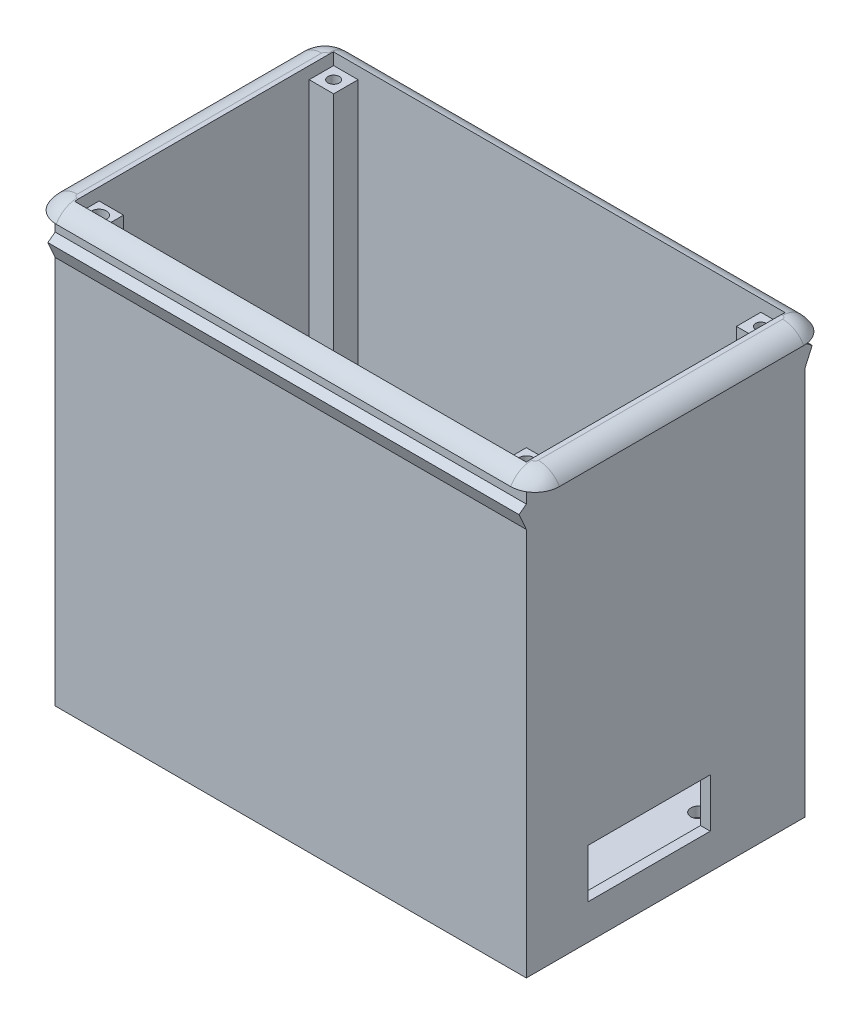
from build123d import *

# Parameters (mm, degrees)
BOSS_EXTRUDE1_DEPTH = 2.5
FILLET1_R           = 5
SKETCH2_W           = 96.44
SKETCH2_H           = 57
SKETCH2_W_2         = 92.44
SKETCH2_H_2         = 53
BOSS_EXTRUDE2_DEPTH = 85
SKETCH4_W           = 92.44
SKETCH4_H           = 53
CUT_EXTRUDE1_DEPTH  = 104.813534763
SKETCH3_W           = 96.44
SKETCH3_H           = 57
BOSS_EXTRUDE3_DEPTH = 2
BOSS_EXTRUDE4_DEPTH = 96.44
SKETCH6_W           = 5
SKETCH6_H           = 5
BOSS_EXTRUDE5_DEPTH = 85
SKETCH7_R           = 1.6
CUT_EXTRUDE2_DEPTH  = 106.870203551
SKETCH8_W           = 25
SKETCH8_H           = 10
CUT_EXTRUDE3_DEPTH  = 136.694798721
SKETCH9_R           = 1.5
SKETCH9_R_2         = 1.08347565
SKETCH9_R_3         = 1.156670199
CUT_EXTRUDE4_DEPTH  = 106.457337345


with BuildPart() as part:
    # Sketch1 → Boss-Extrude1 (new body)
    with BuildSketch(Plane(origin=(0, 0, 0), x_dir=(1, 0, 0), z_dir=(0, 1, 0))):
        with BuildLine():
            Line((-46.5, 30), (46.5, 30))
            ThreePointArc((46.5, 30), (50.035533906, 28.535533906), (51.5, 25))
            Line((51.5, 25), (51.5, -25))
            ThreePointArc((51.5, -25), (50.035533906, -28.535533906), (46.5, -30))
            Line((46.5, -30), (-46.5, -30))
            ThreePointArc((-46.5, -30), (-50.035533906, -28.535533906), (-51.5, -25))
            Line((-51.5, -25), (-51.5, 25))
            ThreePointArc((-51.5, 25), (-50.035533906, 28.535533906), (-46.5, 30))
        make_face()
    extrude(amount=BOSS_EXTRUDE1_DEPTH)

    # Fillet1
    # the kernel refuses this fillet: 5 mm, written as the material it takes off along each edge
    with BuildSketch(Plane(origin=(-46.5, 2.5, -25), x_dir=(-1, 0, 0), z_dir=(0, 0, 1))) as fillet1_piece_1:
        with BuildLine():
            CenterArc((0.669872981, 5), FILLET1_R, 270, 60)
            Line((0.669872981, 0), (0.669872981, -0.1))
            Line((0.669872981, -0.1), (5, -0.1))
            Line((5, -0.1), (5.1, 0))
            ThreePointArc((5.1, 0), (5.1, 1.25), (5.08660254, 2.45))
            Line((5.08660254, 2.45), (5, 2.5))
        make_face()
    revolve(axis=Axis((-46.5, 2.5, -25), (0, -1, 0)), revolution_arc=90, mode=Mode.SUBTRACT)
    with BuildSketch(Plane(origin=(-46.5, 2.5, -30), x_dir=(0, -1, 0), z_dir=(1, 0, 0)), Plane(origin=(46.5, 2.5, 30), x_dir=(0, -1, 0), z_dir=(-1, 0, 0))) as fillet1_piece_2:
        with BuildLine():
            CenterArc((5, -4.330127019), FILLET1_R, 120, 60)
            Line((0, -4.330127019), (-0.1, -4.330127019))
            Line((-0.1, -4.330127019), (-0.1, 0))
            Line((-0.1, 0), (0, 0.1))
            ThreePointArc((0, 0.1), (1.25, 0.1), (2.45, 0.08660254))
            Line((2.45, 0.08660254), (2.5, 0))
        make_face()
    extrude(amount=93, mode=Mode.SUBTRACT)
    with BuildSketch(Plane(origin=(46.5, 2.5, -25), x_dir=(0, 0, -1), z_dir=(-1, 0, 0))) as fillet1_piece_3:
        with BuildLine():
            CenterArc((0.669872981, 5), FILLET1_R, 270, 60)
            Line((0.669872981, 0), (0.669872981, -0.1))
            Line((0.669872981, -0.1), (5, -0.1))
            Line((5, -0.1), (5.1, 0))
            ThreePointArc((5.1, 0), (5.1, 1.25), (5.08660254, 2.45))
            Line((5.08660254, 2.45), (5, 2.5))
        make_face()
    revolve(axis=Axis((46.5, 2.5, -25), (0, -1, 0)), revolution_arc=90, mode=Mode.SUBTRACT)
    with BuildSketch(Plane(origin=(51.5, 2.5, -25), x_dir=(0, -1, 0), z_dir=(0, 0, 1)), Plane(origin=(-51.5, 2.5, 25), x_dir=(0, -1, 0), z_dir=(0, 0, -1))) as fillet1_piece_4:
        with BuildLine():
            CenterArc((5, -4.330127019), FILLET1_R, 120, 60)
            Line((0, -4.330127019), (-0.1, -4.330127019))
            Line((-0.1, -4.330127019), (-0.1, 0))
            Line((-0.1, 0), (0, 0.1))
            ThreePointArc((0, 0.1), (1.25, 0.1), (2.45, 0.08660254))
            Line((2.45, 0.08660254), (2.5, 0))
        make_face()
    extrude(amount=50, mode=Mode.SUBTRACT)
    with BuildSketch(Plane(origin=(46.5, 2.5, 25), x_dir=(1, 0, 0), z_dir=(0, 0, -1))) as fillet1_piece_5:
        with BuildLine():
            CenterArc((0.669872981, 5), FILLET1_R, 270, 60)
            Line((0.669872981, 0), (0.669872981, -0.1))
            Line((0.669872981, -0.1), (5, -0.1))
            Line((5, -0.1), (5.1, 0))
            ThreePointArc((5.1, 0), (5.1, 1.25), (5.08660254, 2.45))
            Line((5.08660254, 2.45), (5, 2.5))
        make_face()
    revolve(axis=Axis((46.5, 2.5, 25), (0, -1, 0)), revolution_arc=90, mode=Mode.SUBTRACT)
    with BuildSketch(Plane(origin=(-46.5, 2.5, 25), x_dir=(0, 0, 1), z_dir=(1, 0, 0))) as fillet1_piece_6:
        with BuildLine():
            CenterArc((0.669872981, 5), FILLET1_R, 270, 60)
            Line((0.669872981, 0), (0.669872981, -0.1))
            Line((0.669872981, -0.1), (5, -0.1))
            Line((5, -0.1), (5.1, 0))
            ThreePointArc((5.1, 0), (5.1, 1.25), (5.08660254, 2.45))
            Line((5.08660254, 2.45), (5, 2.5))
        make_face()
    revolve(axis=Axis((-46.5, 2.5, 25), (0, -1, 0)), revolution_arc=90, mode=Mode.SUBTRACT)

    # Sketch2 → Boss-Extrude2 (add)
    with BuildSketch(Plane.XZ):
        Rectangle(SKETCH2_W, SKETCH2_H)
        Rectangle(SKETCH2_W_2, SKETCH2_H_2, mode=Mode.SUBTRACT)
    extrude(amount=BOSS_EXTRUDE2_DEPTH)

    # Sketch4 → Cut-Extrude1 (cut, through all)
    with BuildSketch(Plane.XZ):
        Rectangle(SKETCH4_W, SKETCH4_H)
    extrude(amount=-CUT_EXTRUDE1_DEPTH, mode=Mode.SUBTRACT)

    # Sketch3 → Boss-Extrude3 (add)
    with BuildSketch(Plane.XZ.offset(85)):
        Rectangle(SKETCH3_W, SKETCH3_H)
    extrude(amount=BOSS_EXTRUDE3_DEPTH)

    # Sketch5 → Boss-Extrude4 (add)
    with BuildSketch(Plane.ZY.offset(48.22)):
        Polygon((-28.5, -7.5), (-28.5, -3), (-30, -4.114730389), align=None)
    boss_extrude4 = extrude(amount=-BOSS_EXTRUDE4_DEPTH)

    # Mirror1: Boss-Extrude4 across plane
    add(boss_extrude4.mirror(Plane.XY))

    # Sketch6 → Boss-Extrude5 (add)
    with BuildSketch(Plane(origin=(0, -85, 0), x_dir=(1, 0, 0), z_dir=(0, 1, 0))):
        with Locations((43.72, 24)):
            Rectangle(SKETCH6_W, SKETCH6_H)
        with Locations((-43.72, 24)):
            Rectangle(SKETCH6_W, SKETCH6_H)
        with Locations((43.72, -24)):
            Rectangle(SKETCH6_W, SKETCH6_H)
        with Locations((-43.72, -24)):
            Rectangle(SKETCH6_W, SKETCH6_H)
    extrude(amount=BOSS_EXTRUDE5_DEPTH)

    # Sketch7 → Cut-Extrude2 (cut, through all)
    with BuildSketch(Plane(origin=(0, -85, 0), x_dir=(1, 0, 0), z_dir=(0, 1, 0))):
        with Locations(Location((-38.5, 16.5, 0), (0, 0, 270))):
            Circle(SKETCH7_R)
        with Locations(Location((38.5, 16.5, 0), (0, 0, 270))):
            Circle(SKETCH7_R)
        with Locations(Location((-38.5, -16.5, 0), (0, 0, 270))):
            Circle(SKETCH7_R)
        with Locations(Location((38.5, -16.5, 0), (0, 0, 270))):
            Circle(SKETCH7_R)
    extrude(amount=-CUT_EXTRUDE2_DEPTH, mode=Mode.SUBTRACT)

    # Sketch8 → Cut-Extrude3 (cut, through all)
    with BuildSketch(Plane(origin=(48.22, 0, 0), x_dir=(0, 0, -1), z_dir=(1, 0, 0))):
        with Locations((-3.355310765, -74.801411427)):
            Rectangle(SKETCH8_W, SKETCH8_H)
    extrude(amount=-CUT_EXTRUDE3_DEPTH, mode=Mode.SUBTRACT)

    # Sketch9 → Cut-Extrude4 (cut, through all)
    with BuildSketch(Plane(origin=(0, 0, 0), x_dir=(1, 0, 0), z_dir=(0, 1, 0))):
        with Locations(Location((-43.72, -24, 0), (0, 0, 270))):
            Circle(SKETCH9_R)
        with Locations(Location((43.72, -24, 0), (0, 0, 270))):
            Circle(SKETCH9_R)
        with Locations(Location((43.72, 24, 0), (0, 0, 270))):
            Circle(SKETCH9_R_2)
        with Locations(Location((-43.72, 24, 0), (0, 0, 270))):
            Circle(SKETCH9_R_3)
    extrude(amount=-CUT_EXTRUDE4_DEPTH, mode=Mode.SUBTRACT)


solid = part.part
